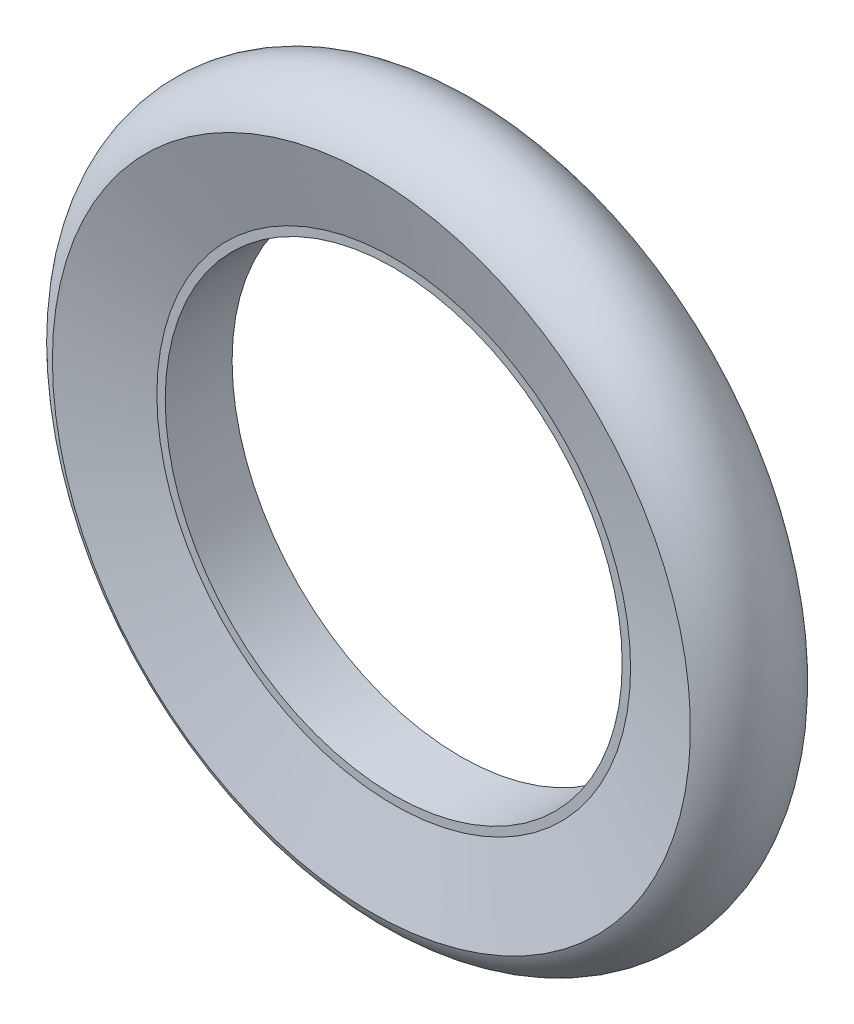
from build123d import *


with BuildPart() as part:
    # Sketch1 → Revolve1 (revolve)
    with BuildSketch(Plane(origin=(0, 0, 0), x_dir=(1, 0, 0), z_dir=(0, 1, 0))):
        with BuildLine():
            Line((-229, -40), (-170, -24))
            Line((-170, -24), (-164, -24))
            Line((-164, -24), (-164, 24))
            Line((-164, 24), (-170, 24))
            Line((-170, 24), (-229, 40))
            ThreePointArc((-229, 40), (-255, 0), (-229, -40))
        make_face()
    revolve(axis=Axis((0, 0, -36.464321623), (0, 0, 1)))


solid = part.part
